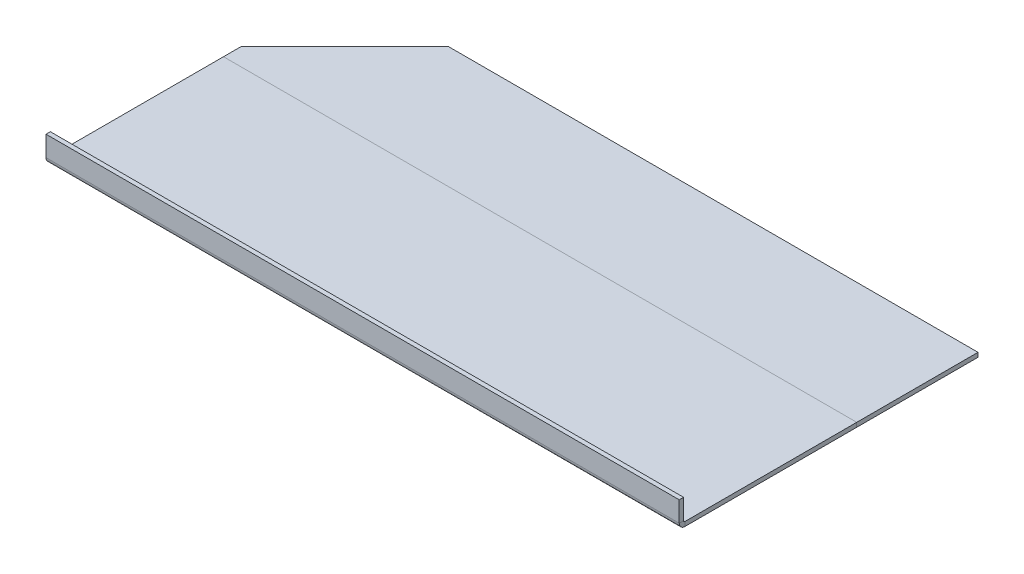
from build123d import *

# Parameters (mm, degrees)
POWER_ELECTRONICS_WALL_DEPTH = 3.175
SKETCH5_W                    = 464.185
SKETCH5_H                    = 127.5715
BASE_FLANGE1_DEPTH           = 3.175
EDGE_FLANGE1_STRIP_W         = 17.24
EDGE_FLANGE1_STRIP_H         = 3.175
EDGE_FLANGE1_STRIP_CUT_DEPTH = 464.185
EDGE_FLANGE1_DEPTH           = 464.185


# Sheet-metal steps are written as plain solids
with BuildPart() as part:
    # Sketch2 → Power Electronics Wall (new body)
    with BuildSketch(Plane(origin=(0, 0, 0), x_dir=(1, 0, 0), z_dir=(0, 1, 0))):
        Polygon((-232.0925, 63.78575), (232.0925, 63.78575), (232.0925, 152.68575), (-155.8925, 152.68575), (-232.0925, 76.48575), align=None)
    extrude(amount=-POWER_ELECTRONICS_WALL_DEPTH)


with BuildPart() as body_2:
    # Sketch5 → Base-Flange1 (new body)
    with BuildSketch(Plane(origin=(0, 0, 0), x_dir=(1, 0, 0), z_dir=(0, 1, 0))):
        Rectangle(SKETCH5_W, SKETCH5_H)
    extrude(amount=-BASE_FLANGE1_DEPTH)

    # Edge-Flange1 strip (across the edge) → Edge-Flange1 strip cut (cut)
    with BuildSketch(Plane(origin=(-232.0925, 0, 66.32575), x_dir=(0, 0, -1), z_dir=(1, 0, 0))):
        with Locations((-4.445, -1.5875)):
            Rectangle(EDGE_FLANGE1_STRIP_W, EDGE_FLANGE1_STRIP_H)
    extrude(amount=EDGE_FLANGE1_STRIP_CUT_DEPTH, mode=Mode.SUBTRACT)

    # Edge-Flange1 section (across the edge) → Edge-Flange1 (add)
    with BuildSketch(Plane(origin=(-232.0925, 0, 66.32575), x_dir=(0, 0, -1), z_dir=(1, 0, 0))):
        with BuildLine():
            Line((0, 1), (0, 15.875))
            Line((0, 15.875), (3.175, 15.875))
            Line((3.175, 15.875), (3.175, 1))
            ThreePointArc((3.175, 1), (3.467893219, 0.292893219), (4.175, 0))
            Line((4.175, 0), (4.175, -3.175))
            ThreePointArc((4.175, -3.175), (1.222829189, -1.952170811), (0, 1))
        make_face()
    extrude(amount=EDGE_FLANGE1_DEPTH)


solid = Compound([part.part, body_2.part])
